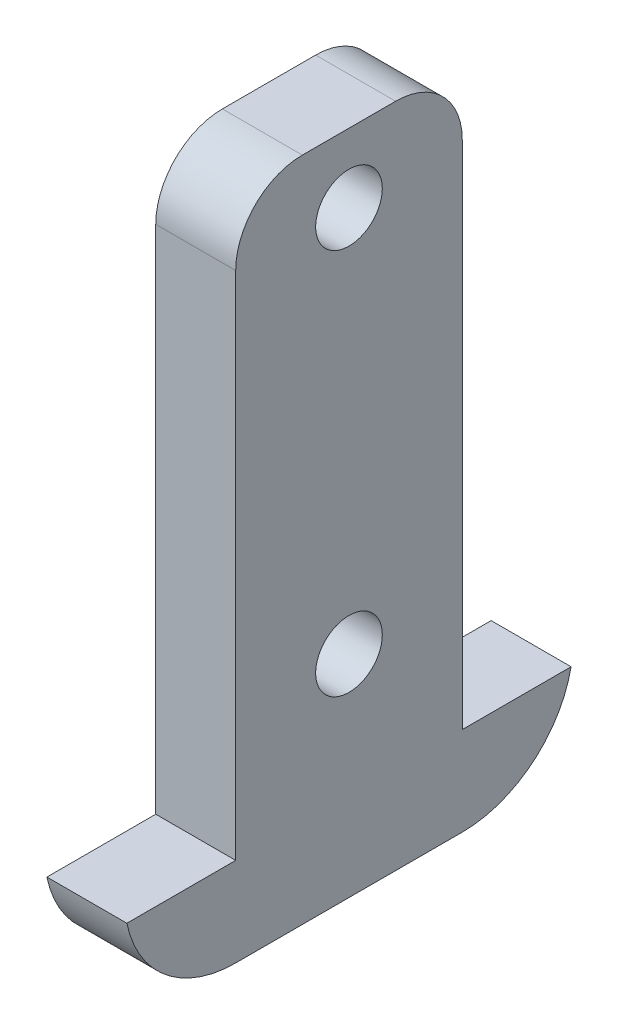
from build123d import *

# Parameters (mm, degrees)
ESBO_O1_R                = 1.5
RESSALTO_EXTRUS_O1_DEPTH = 3.6
FILETE1_R                = 3
FILETE2_R                = 5


with BuildPart() as part:
    # Esboço1 → Ressalto-extrusão1 (new body)
    with BuildSketch(Plane(origin=(0, 0, 0), x_dir=(0, 0, -1), z_dir=(1, 0, 0))):
        Polygon((0, 0), (20, 0), (20, 4), (15.1, 4), (15.1, 30), (4.9, 30), (4.9, 4), (0, 4), align=None)
        with Locations((10, 26.9)):
            Circle(ESBO_O1_R, mode=Mode.SUBTRACT)
        with Locations((10, 9.5)):
            Circle(ESBO_O1_R, mode=Mode.SUBTRACT)
    extrude(amount=RESSALTO_EXTRUS_O1_DEPTH)

    # Filete1
    filete1_edges = [part.edges().sort_by_distance(p)[0] for p in [
        (1.8, 30, -4.9),
        (1.8, 30, -15.1),
    ]]
    fillet(filete1_edges, radius=FILETE1_R)

    # Filete2
    # the kernel refuses this fillet: 5 mm, written as the material it takes off along each edge
    with BuildSketch(Plane(origin=(-12.247448714, 0, 0), x_dir=(0, 0, -1), z_dir=(1, 0, 0))) as filete2_piece_1:
        with BuildLine():
            CenterArc((4.898979486, 5), FILETE2_R, 191.536959033, 78.463040967)
            Line((0, 4), (-0.09797959, 3.98))
            ThreePointArc((-0.09797959, 3.98), (-0.1, 2), (-0.1, 0))
            Line((-0.1, 0), (0, -0.1))
            Line((0, -0.1), (4.898979486, -0.1))
            Line((4.898979486, -0.1), (4.898979486, 0))
        make_face()
    extrude(amount=28.094897428, mode=Mode.SUBTRACT)
    with BuildSketch(Plane(origin=(-12.247448714, 0, -20), x_dir=(0, 1.0, 1.5667467323505199e-12), z_dir=(1, 0, 0))) as filete2_piece_2:
        with BuildLine():
            CenterArc((5, 4.898979486), FILETE2_R, 180, 78.463040967)
            Line((0, 4.898979486), (-0.1, 4.898979486))
            Line((-0.1, 4.898979486), (-0.1, 0))
            Line((-0.1, 0), (0, -0.1))
            ThreePointArc((0, -0.1), (2, -0.1), (3.98, -0.09797959))
            Line((3.98, -0.09797959), (4, 0))
        make_face()
    extrude(amount=28.094897428, mode=Mode.SUBTRACT)


solid = part.part
